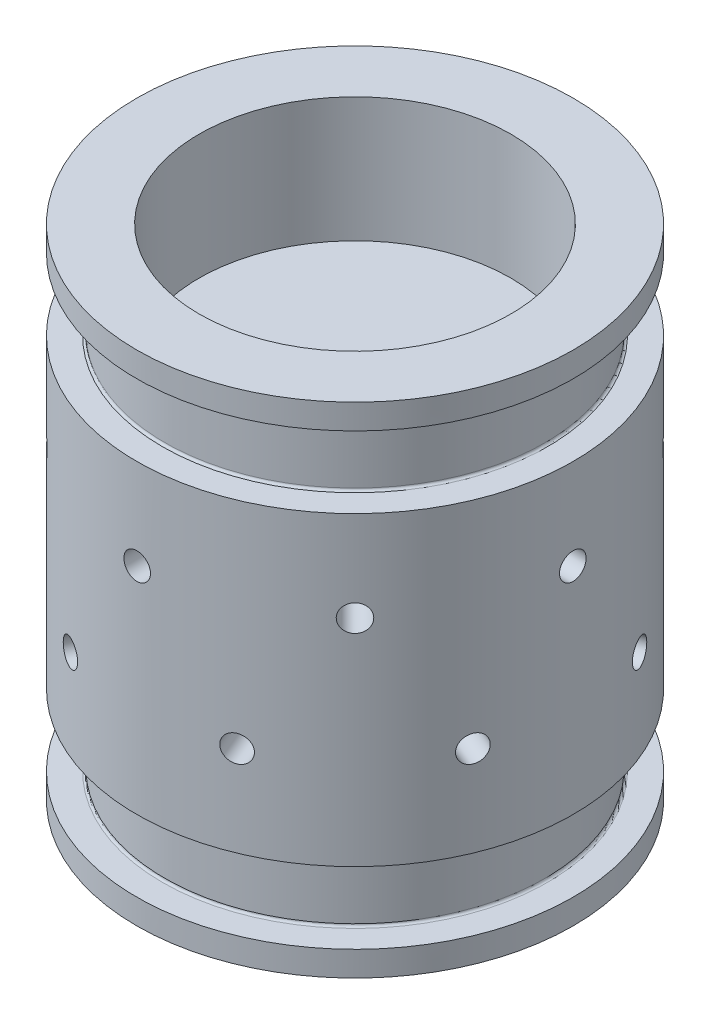
from build123d import *

# Parameters (mm, degrees)
SKETCH1_R                 = 22.225
BODY_DEPTH                = 25.4
SKETCH2_R                 = 15.875
LIGHTENING_HOLE_DEPTH     = 12.7
TAPPED_HOLE_PATTERN_COUNT = 8


with BuildPart() as part:
    # Sketch1 → body (new, symmetric)
    with BuildSketch(Plane(origin=(0, 0, 0), x_dir=(1, 0, 0), z_dir=(0, 1, 0))):
        Circle(SKETCH1_R)
    extrude(amount=BODY_DEPTH, both=True)

    # Sketch2 → lightening hole (cut)
    with BuildSketch(Plane(origin=(0, 25.4, 0), x_dir=(1, 0, 0), z_dir=(0, 1, 0))):
        Circle(SKETCH2_R)
    lightening_hole = extrude(amount=-LIGHTENING_HOLE_DEPTH, mode=Mode.SUBTRACT)

    # main-o-ring → o-ring-main (with backup rings) (revolve, cut)
    with BuildSketch(Plane.XY):
        with BuildLine():
            Line((-22.225, 22.86), (-22.225, 15.5702))
            Line((-22.225, 15.5702), (-19.620412385, 15.5702))
            ThreePointArc((-19.620412385, 15.5702), (-19.450556579, 15.640556579), (-19.3802, 15.810412385))
            Line((-19.3802, 15.810412385), (-19.3802, 22.619787615))
            ThreePointArc((-19.3802, 22.619787615), (-19.450556579, 22.789643421), (-19.620412385, 22.86))
            Line((-19.620412385, 22.86), (-22.225, 22.86))
        make_face()
    o_ring_main_with_backup_rings = revolve(axis=Axis((0, 0, 0), (0, 1, 0)), mode=Mode.SUBTRACT)

    # Top-Bottom Symmetry: lightening hole, o-ring-main (with backup rings) across plane
    add(lightening_hole.mirror(Plane.ZX), mode=Mode.SUBTRACT)
    add(o_ring_main_with_backup_rings.mirror(Plane.ZX), mode=Mode.SUBTRACT)

    # Sketch3 → #6-32 Tapped Hole1 (revolve, cut)
    with BuildSketch(Plane(origin=(-22.225, 6.35, 0), x_dir=(0, 0, 1), z_dir=(0, 1, 0))):
        Polygon((0, 0), (0, 8.76289403), (1.35255, 7.9502), (1.35255, 0), align=None)
    f_6_32_tapped_hole1 = revolve(axis=Axis((-28.575, 6.35, 0), (1, 0, 0)), mode=Mode.SUBTRACT)

    # Sketch4 → #6-32 Tapped Hole2 (revolve, cut)
    with BuildSketch(Plane(origin=(-20.53322261, -6.35, -8.505139284), x_dir=(-0.38268343236509, 0, 0.9238795325112867), z_dir=(0, 1, 0))):
        Polygon((0, 0), (0, 8.76289403), (1.35255, 7.9502), (1.35255, 0), align=None)
    f_6_32_tapped_hole2 = revolve(axis=Axis((-26.399857642, -6.35, -10.93517908), (0.9238795325112867, 0, 0.38268343236508995)), mode=Mode.SUBTRACT)

    # Tapped Hole Pattern: #6-32 Tapped Hole1, #6-32 Tapped Hole2 ×8 about axis
    tapped_hole_pattern_axis = Axis((0, 25.4, 0), (0, -1, 0))
    add([f_6_32_tapped_hole1.rotate(tapped_hole_pattern_axis, i * 360 / TAPPED_HOLE_PATTERN_COUNT) for i in range(1, TAPPED_HOLE_PATTERN_COUNT)], mode=Mode.SUBTRACT)
    add([f_6_32_tapped_hole2.rotate(tapped_hole_pattern_axis, i * 360 / TAPPED_HOLE_PATTERN_COUNT) for i in range(1, TAPPED_HOLE_PATTERN_COUNT)], mode=Mode.SUBTRACT)


solid = part.part
